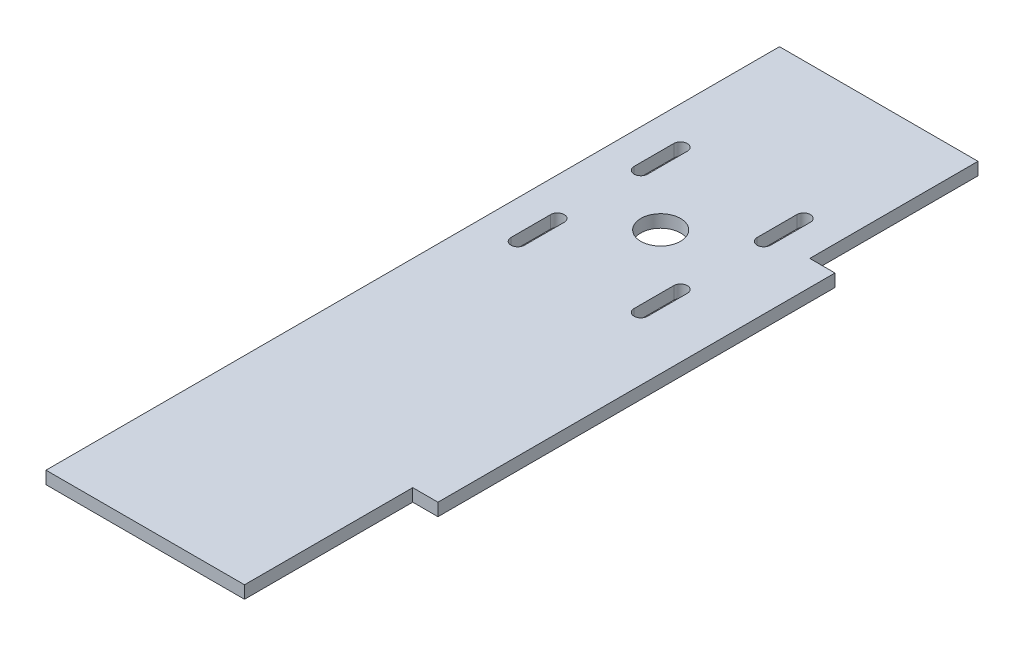
from build123d import *

# Parameters (mm, degrees)
BOSS_EXTRUDE1_DEPTH  = 3.175
SKETCH2_R            = 5
CUT_EXTRUDE1_DEPTH   = 146.820244651
M3_CLEARANCE_HOLE1_D = 3.4
CUT_EXTRUDE2_DEPTH   = 146.820244651


with BuildPart() as part:
    # Sketch1 → Boss-Extrude1 (new body)
    with BuildSketch(Plane(origin=(0, 0, 0), x_dir=(1, 0, 0), z_dir=(0, 1, 0))):
        Polygon((25, 42.375), (-25, 42.375), (-25, 0), (-25, -100), (-25, -142.375), (25, -142.375), (25, -100), (31.35, -100), (31.35, 0), (25, 0), align=None)
    extrude(amount=BOSS_EXTRUDE1_DEPTH)

    # Sketch2 → Cut-Extrude1 (cut, through all)
    with BuildSketch(Plane(origin=(0, 3.175, 0), x_dir=(1, 0, 0), z_dir=(0, 1, 0))):
        with Locations((0, -12.55)):
            Circle(SKETCH2_R)
    extrude(amount=-CUT_EXTRUDE1_DEPTH, mode=Mode.SUBTRACT)

    # M3 Clearance Hole1 (through all)
    with Locations(Plane(origin=(0, 3.175, 0), x_dir=(1, 0, 0), z_dir=(0, 1, 0))):
        with Locations((-15.5, 2.95), (15.5, 2.95), (15.5, -28.05), (-15.5, -28.05)):
            Hole(M3_CLEARANCE_HOLE1_D / 2)

    # Sketch7 → Cut-Extrude2 (cut, through all)
    with BuildSketch(Plane(origin=(0, 3.175, 0), x_dir=(1, 0, 0), z_dir=(0, 1, 0))):
        with BuildLine():
            Line((17.2, 7.95), (17.2, -2.05))
            ThreePointArc((17.2, -2.05), (15.5, -3.75), (13.8, -2.05))
            Line((13.8, -2.05), (13.8, 7.95))
            ThreePointArc((13.8, 7.95), (15.5, 9.65), (17.2, 7.95))
        make_face()
        with BuildLine():
            Line((-13.8, 7.95), (-13.8, -2.05))
            ThreePointArc((-13.8, -2.05), (-15.5, -3.75), (-17.2, -2.05))
            Line((-17.2, -2.05), (-17.2, 7.95))
            ThreePointArc((-17.2, 7.95), (-15.5, 9.65), (-13.8, 7.95))
        make_face()
        with BuildLine():
            Line((17.2, -33.05), (17.2, -23.05))
            ThreePointArc((17.2, -23.05), (15.5, -21.35), (13.8, -23.05))
            Line((13.8, -23.05), (13.8, -33.05))
            ThreePointArc((13.8, -33.05), (15.5, -34.75), (17.2, -33.05))
        make_face()
        with BuildLine():
            Line((-13.8, -33.05), (-13.8, -23.05))
            ThreePointArc((-13.8, -23.05), (-15.5, -21.35), (-17.2, -23.05))
            Line((-17.2, -23.05), (-17.2, -33.05))
            ThreePointArc((-17.2, -33.05), (-15.5, -34.75), (-13.8, -33.05))
        make_face()
    extrude(amount=-CUT_EXTRUDE2_DEPTH, mode=Mode.SUBTRACT)


solid = part.part
